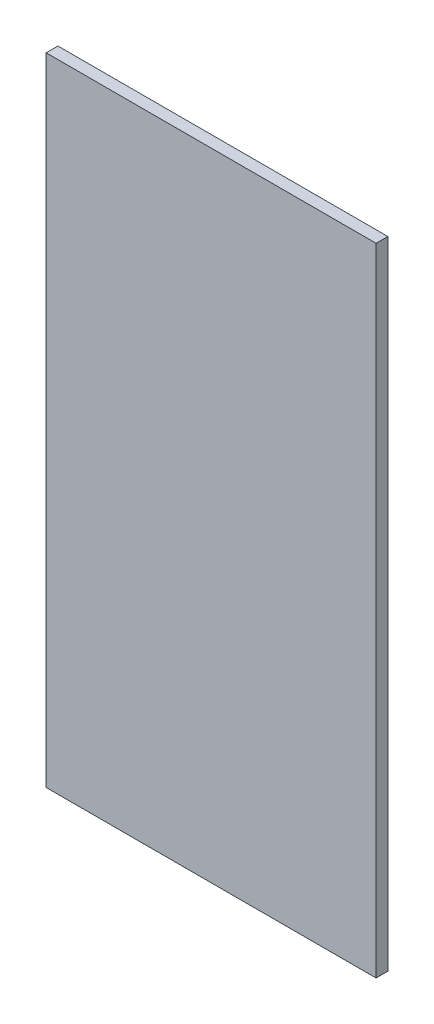
from build123d import *

# Parameters (mm, degrees)
SKETCH1_W           = 177.8
SKETCH1_H           = 342.9
BOSS_EXTRUDE1_DEPTH = 6.35


with BuildPart() as part:
    # Sketch1 → Boss-Extrude1 (new body)
    with BuildSketch(Plane.XY):
        with Locations((63.5, -152.4)):
            Rectangle(SKETCH1_W, SKETCH1_H)
    extrude(amount=BOSS_EXTRUDE1_DEPTH)


solid = part.part
